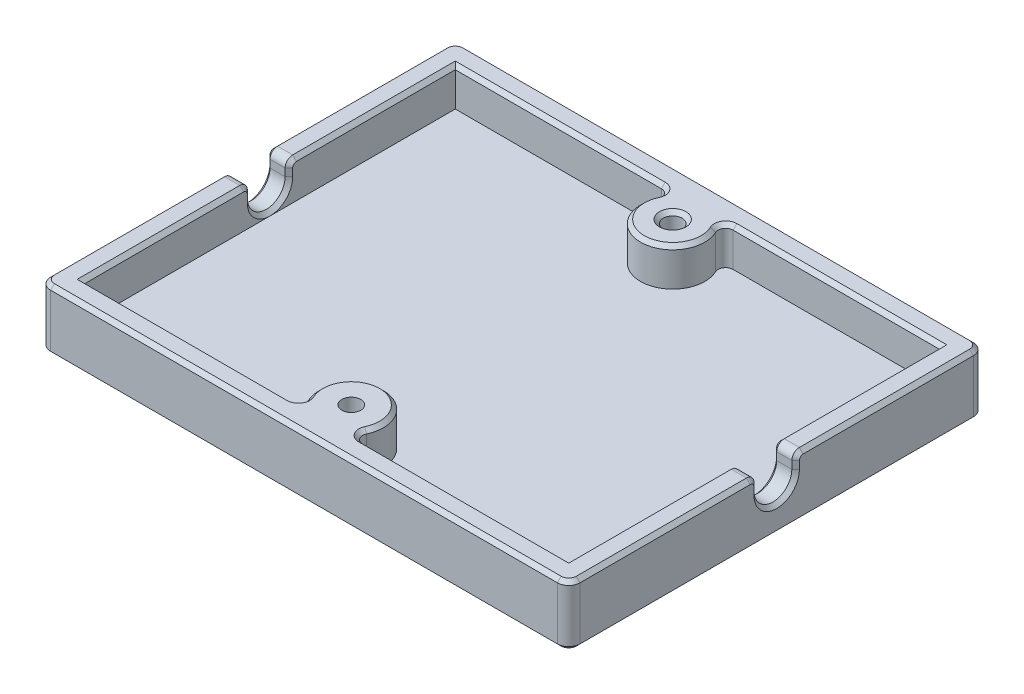
from build123d import *

# Parameters (mm, degrees)
SKETCH1_W           = 140
SKETCH1_H           = 110
BOSS_EXTRUDE1_DEPTH = 16
SKETCH2_R           = 2.5
CUT_EXTRUDE1_DEPTH  = 91.44888059
FILLET1_R           = 3
SHELL1_T            = -6
CUT_EXTRUDE2_DEPTH  = 152.26466871
FILLET2_R           = 2
CHAMFER2_SIZE       = 1


with BuildPart() as part:
    # Sketch1 → Boss-Extrude1 (new body)
    with BuildSketch(Plane(origin=(0, 0, 0), x_dir=(1, 0, 0), z_dir=(0, 1, 0))):
        Rectangle(SKETCH1_W, SKETCH1_H)
    extrude(amount=BOSS_EXTRUDE1_DEPTH)

    # Sketch2 → Cut-Extrude1 (cut, through all)
    with BuildSketch(Plane(origin=(0, 16, 0), x_dir=(1, 0, 0), z_dir=(0, 1, 0))):
        with Locations(Location((0, 42.5, 0), (0, 0, 270))):
            Circle(SKETCH2_R)
        with Locations(Location((0, -42.5, 0), (0, 0, 90))):
            Circle(SKETCH2_R)
    extrude(amount=-CUT_EXTRUDE1_DEPTH, mode=Mode.SUBTRACT)

    # Fillet1
    fillet1_edges = [part.edges().sort_by_distance(p)[0] for p in [
        (70, 8, 55),
        (-70, 8, 55),
        (-70, 8, -55),
        (70, 8, -55),
    ]]
    fillet(fillet1_edges, radius=FILLET1_R)

    # Shell1
    shell1_openings = [part.faces().sort_by_distance(p)[0] for p in [
        (0, 16, 0),
    ]]
    offset(amount=SHELL1_T, openings=shell1_openings, kind=Kind.INTERSECTION)

    # Sketch3 → Cut-Extrude2 (cut, through all)
    with BuildSketch(Plane(origin=(70, 0, 0), x_dir=(0, 0, -1), z_dir=(1, 0, 0))):
        with BuildLine():
            Line((5, 20), (5, 12))
            ThreePointArc((5, 12), (0, 7), (-5, 12))
            Line((-5, 12), (-5, 20))
            ThreePointArc((-5, 20), (0, 25), (5, 20))
        make_face()
    extrude(amount=-CUT_EXTRUDE2_DEPTH, mode=Mode.SUBTRACT)

    # Fillet2
    fillet2_edges = [part.edges().sort_by_distance(p)[0] for p in [
        (-5.477225575, 11, -49),
        (5.477225575, 11, 49),
        (-5.477225575, 11, 49),
        (5.477225575, 11, -49),
        (67, 16, -5),
        (-67, 16, -5),
        (67, 16, 5),
        (-67, 16, 5),
    ]]
    fillet(fillet2_edges, radius=FILLET2_R)

    # Chamfer2
    chamfer2_edges = [part.edges().sort_by_distance(p)[0] for p in [
        (64, 13, -5),
        (64, 16, -28),
        (64, 15.414213562, -5.585786438),
        (64, 15.414213562, 5.585786438),
        (70, 13, 5),
        (70, 16, -29.5),
        (70, 15.414213562, -5.585786438),
        (70, 15.414213562, 5.585786438),
        (-36.74341649, 16, -49),
        (0, 16, -34),
        (-64, 13, 5),
        (-64, 15.414213562, 5.585786438),
        (-64, 15.414213562, -5.585786438),
        (-70, 13, 5),
        (-70, 15.414213562, 5.585786438),
        (-70, 15.414213562, -5.585786438),
        (-7.796524471, 16, 48.069044968),
        (7.796524471, 16, 48.069044968),
        (7.796524471, 16, -48.069044968),
        (-7.796524471, 16, -48.069044968),
        (0, 0, -45),
        (0, 16, -45),
        (0, 0, 45),
        (-70, 0, 0),
        (-70, 16, -29.5),
        (70, 0, 0),
        (0, 0, 55),
        (0, 0, -55),
        (69.121320344, 0, 54.121320344),
        (-69.121320344, 0, 54.121320344),
        (69.121320344, 0, -54.121320344),
        (-69.121320344, 0, -54.121320344),
        (0, 16, -55),
        (70, 16, 29.5),
        (0, 16, 55),
        (69.121320344, 16, 54.121320344),
        (-69.121320344, 16, 54.121320344),
        (69.121320344, 16, -54.121320344),
        (-69.121320344, 16, -54.121320344),
        (36.74341649, 16, -49),
        (-64, 16, -28),
        (-36.74341649, 16, 49),
        (64, 16, 28),
        (-64, 7, 0),
        (-64, 13, -5),
        (70, 13, -5),
        (70, 7, 0),
        (-70, 13, -5),
        (64, 7, 0),
        (-70, 7, 0),
        (64, 13, 5),
        (36.74341649, 16, 49),
        (0, 16, 34),
        (-64, 16, 28),
        (-70, 16, 29.5),
    ]]
    chamfer(chamfer2_edges, length=CHAMFER2_SIZE - 0.0001)  # a hair under: the kernel refuses the full size


solid = part.part
